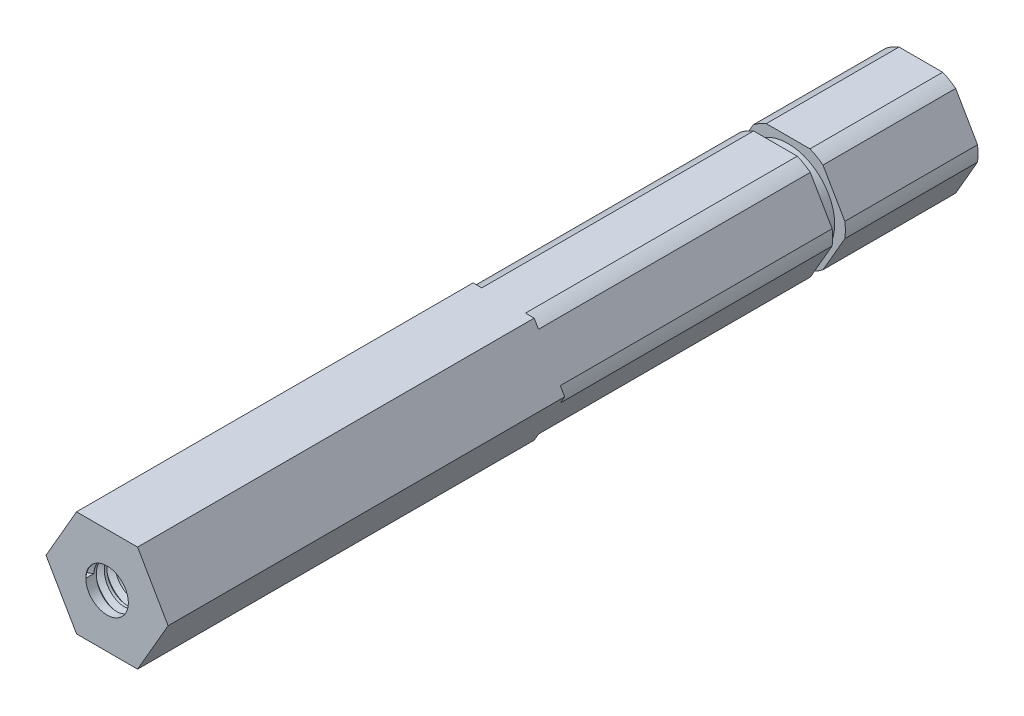
from build123d import *
from build123d.topology import SkipClean

# Parameters (mm, degrees)
EXTRUSI_N_HEX_PROFILE_DEPTH = 48.86325
TAP_START                   = 48.86325
CROQUIS3_R                  = 2.5527
TAP_HOLE_1_DEPTH            = 19.05
THUNDERHEX_START            = -48.86325
CROQUIS7_OUTSIDE_W          = 36.59
CROQUIS7_OUTSIDE_H          = 34.626
CROQUIS7_OUTSIDE_R          = 6.8707
THUNDERHEX_DEPTH            = 50.1015
CROQUIS13_OUTSIDE_W         = 36.59
CROQUIS13_OUTSIDE_H         = 34.626
CROQUIS13_OUTSIDE_R         = 5.588
CORTAR_EXTRUIR1_DEPTH       = 1.524
ROSCA1_PITCH                = 1.27


with BuildPart() as part:
    # Croquis2 → Extrusión Hex Profile (new, symmetric)
    with BuildSketch(Plane.XY):
        Polygon((3.666174209, -6.35), (7.332348419, 0), (3.666174209, 6.35), (-3.666174209, 6.35), (-7.332348419, 0), (-3.666174209, -6.35), align=None)
    extrude(amount=EXTRUSI_N_HEX_PROFILE_DEPTH, both=True)

    # Croquis3 → Tap Hole 1 (cut)
    with BuildSketch(Plane.XY.offset(TAP_START)):
        Circle(CROQUIS3_R)
    extrude(amount=-TAP_HOLE_1_DEPTH, mode=Mode.SUBTRACT)

    # Croquis7 outside → ThunderHex (cut)
    with BuildSketch(Plane.XY.offset(THUNDERHEX_START)):
        Rectangle(CROQUIS7_OUTSIDE_W, CROQUIS7_OUTSIDE_H)
        Circle(CROQUIS7_OUTSIDE_R, mode=Mode.SUBTRACT)
    extrude(amount=THUNDERHEX_DEPTH, mode=Mode.SUBTRACT)

    # Croquis13 outside → Cortar-Extruir1 (cut)
    with BuildSketch(Plane(origin=(0, 0, -31.40075), x_dir=(-1, 0, 0), z_dir=(0, 0, -1))):
        Rectangle(CROQUIS13_OUTSIDE_W, CROQUIS13_OUTSIDE_H)
        with Locations(Location((0, 0, 0), (0, 0, 180))):
            Circle(CROQUIS13_OUTSIDE_R, mode=Mode.SUBTRACT)
    extrude(amount=CORTAR_EXTRUIR1_DEPTH, mode=Mode.SUBTRACT)

    # Rosca1: the profile of Perfil de rosca1 profile screwed along a right-hand helix of 15 turns, 8 arcs to a turn; built about Z, then put on its axis
    with SkipClean():  # the faces are left unmerged after this step: merging them gives an invalid solid
        rosca1_z = Axis((0, 0, 0), (0, 0, 1))
        rosca1_corners = [(2.5524, 0, -0.000173205), (3.240107661, 0, 0.396874998), (3.240107661, 0, 0.555624998), (2.5524, 0, 0.952673202)]
        with BuildLine(mode=Mode.PRIVATE) as rosca1_profile:
            Line(rosca1_corners[0], rosca1_corners[1])
            Line(rosca1_corners[1], rosca1_corners[2])
            Line(rosca1_corners[2], rosca1_corners[3])
            Line(rosca1_corners[3], rosca1_corners[0])
        rosca1_cap = Face(rosca1_profile.wire())
        rosca1_turn_angles = [0, 22.5, 45, 67.5, 90, 112.5, 135, 157.5, 180, 202.5, 225, 247.5, 270, 292.5, 315, 337.5, 360]
        rosca1_turn_weights = [1, 0.9238795325112867, 1, 0.9238795325112867, 1, 0.9238795325112867, 1, 0.9238795325112867, 1, 0.9238795325112867, 1, 0.9238795325112867, 1, 0.9238795325112867, 1, 0.9238795325112867, 1]
        rosca1_turn_rails = [Edge.make_bspline([Vector(p[0], p[1], 0).rotate(rosca1_z, rosca1_turn_angles[k]) / rosca1_turn_weights[k] + Vector(0, 0, p[2] + ROSCA1_PITCH * rosca1_turn_angles[k] / 360) for k in range(17)], [0, 0, 0, 1, 1, 2, 2, 3, 3, 4, 4, 5, 5, 6, 6, 7, 7, 8, 8, 8], 2, rosca1_turn_weights) for p in rosca1_corners]
        rosca1_turn_sides = [Face.make_surface_from_curves(rosca1_turn_rails[p[0]], rosca1_turn_rails[p[1]]) for p in [(0, 1), (1, 2), (2, 3), (3, 0)]]
        rosca1 = Plane(origin=(0, 0, 48.86325), x_dir=(-1, 0, 0), z_dir=(0, 0, -1)) * Solid(Shell([*[p.moved(Location((0, 0, ROSCA1_PITCH * i))) for i in range(15) for p in rosca1_turn_sides], rosca1_cap, rosca1_cap.rotate(rosca1_z, 5400).moved(Location((0, 0, ROSCA1_PITCH * 5400 / 360)))]))
        add(rosca1, mode=Mode.SUBTRACT)


solid = part.part
